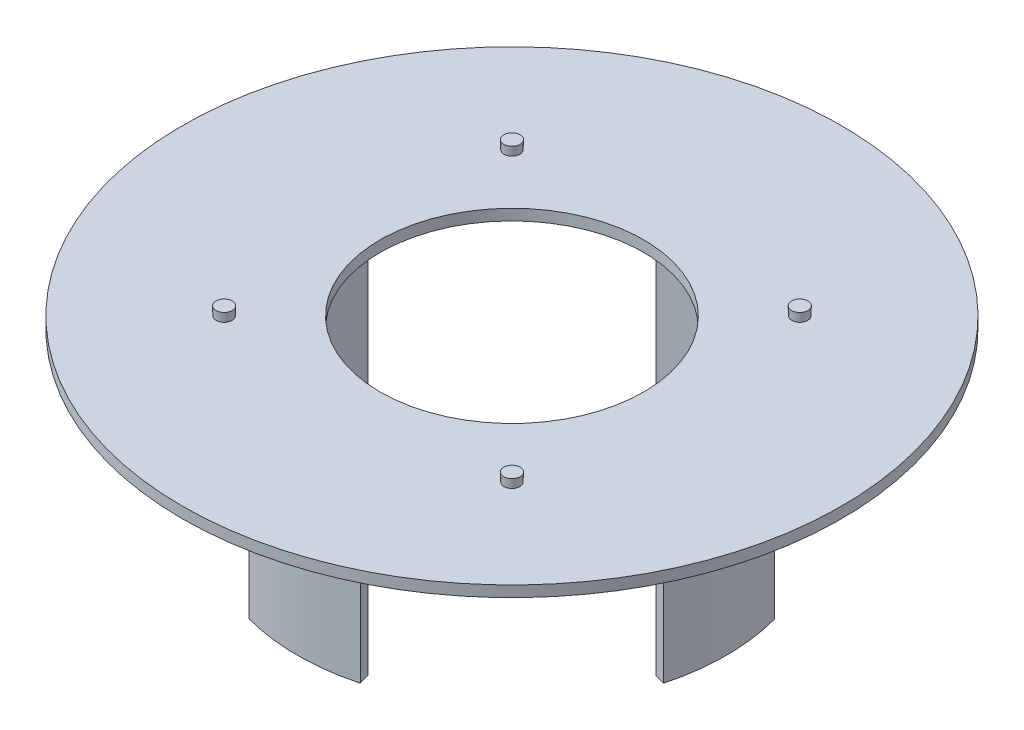
from build123d import *

# Parameters (mm, degrees)
SKETCH1_R                     = 75
SKETCH1_R_2                   = 30
BOSS_EXTRUDE1_DEPTH           = 2.5
SKETCH2_R                     = 1.8
BOSS_EXTRUDE2_DEPTH           = 2
BOSS_EXTRUDE2_DRAFT           = -2
BOSS_EXTRUDE2_PROFILE_2_DEPTH = 2
BOSS_EXTRUDE2_PROFILE_2_DRAFT = -2
BOSS_EXTRUDE2_PROFILE_3_DEPTH = 2
BOSS_EXTRUDE2_PROFILE_3_DRAFT = -2
BOSS_EXTRUDE2_PROFILE_4_DEPTH = 2
BOSS_EXTRUDE2_PROFILE_4_DRAFT = -2
BOSS_EXTRUDE3_DEPTH           = 40


with BuildPart() as part:
    # Sketch1 → Boss-Extrude1 (new body)
    with BuildSketch(Plane(origin=(0, 0, 0), x_dir=(1, 0, 0), z_dir=(0, 1, 0))):
        Circle(SKETCH1_R)
        Circle(SKETCH1_R_2, mode=Mode.SUBTRACT)
    extrude(amount=BOSS_EXTRUDE1_DEPTH)


with BuildPart() as boss_extrude2_tool:
    # Sketch2 → Boss-Extrude2 (with draft: the straight prism first)
    with BuildSketch(Plane(origin=(0, 2.5, 0), x_dir=(1, 0, 0), z_dir=(0, 1, 0))):
        with Locations((-32.75, 32.75)):
            Circle(SKETCH2_R)
    extrude(amount=BOSS_EXTRUDE2_DEPTH)
    # Boss-Extrude2: the draft: its side faces are tilted about the plane it starts from
    boss_extrude2_sides = [boss_extrude2_tool.faces().sort_by_distance(p)[0] for p in [
        (-34.55, 3.5, -32.75),
    ]]
    draft(boss_extrude2_sides, Plane(origin=(0, 2.5, 0), x_dir=(1, 0, 0), z_dir=(0, 1, 0)), BOSS_EXTRUDE2_DRAFT)


with BuildPart() as part_1:
    add(part.part)

    # Boss-Extrude2: add boss_extrude2_tool
    add(boss_extrude2_tool.part)


with BuildPart() as boss_extrude2_profile_2_tool:
    # Sketch2 → Boss-Extrude2 profile 2 (with draft: the straight prism first)
    with BuildSketch(Plane(origin=(0, 2.5, 0), x_dir=(1, 0, 0), z_dir=(0, 1, 0))):
        with Locations((-32.75, -32.75)):
            Circle(SKETCH2_R)
    extrude(amount=BOSS_EXTRUDE2_PROFILE_2_DEPTH)
    # Boss-Extrude2 profile 2: the draft: its side faces are tilted about the plane it starts from
    boss_extrude2_profile_2_sides = [boss_extrude2_profile_2_tool.faces().sort_by_distance(p)[0] for p in [
        (-34.55, 3.5, 32.75),
    ]]
    draft(boss_extrude2_profile_2_sides, Plane(origin=(0, 2.5, 0), x_dir=(1, 0, 0), z_dir=(0, 1, 0)), BOSS_EXTRUDE2_PROFILE_2_DRAFT)


with BuildPart() as part_2:
    add(part_1.part)

    # Boss-Extrude2 profile 2: add boss_extrude2_profile_2_tool
    add(boss_extrude2_profile_2_tool.part)


with BuildPart() as boss_extrude2_profile_3_tool:
    # Sketch2 → Boss-Extrude2 profile 3 (with draft: the straight prism first)
    with BuildSketch(Plane(origin=(0, 2.5, 0), x_dir=(1, 0, 0), z_dir=(0, 1, 0))):
        with Locations((32.75, -32.75)):
            Circle(SKETCH2_R)
    extrude(amount=BOSS_EXTRUDE2_PROFILE_3_DEPTH)
    # Boss-Extrude2 profile 3: the draft: its side faces are tilted about the plane it starts from
    boss_extrude2_profile_3_sides = [boss_extrude2_profile_3_tool.faces().sort_by_distance(p)[0] for p in [
        (30.95, 3.5, 32.75),
    ]]
    draft(boss_extrude2_profile_3_sides, Plane(origin=(0, 2.5, 0), x_dir=(1, 0, 0), z_dir=(0, 1, 0)), BOSS_EXTRUDE2_PROFILE_3_DRAFT)


with BuildPart() as part_3:
    add(part_2.part)

    # Boss-Extrude2 profile 3: add boss_extrude2_profile_3_tool
    add(boss_extrude2_profile_3_tool.part)


with BuildPart() as boss_extrude2_profile_4_tool:
    # Sketch2 → Boss-Extrude2 profile 4 (with draft: the straight prism first)
    with BuildSketch(Plane(origin=(0, 2.5, 0), x_dir=(1, 0, 0), z_dir=(0, 1, 0))):
        with Locations((32.75, 32.75)):
            Circle(SKETCH2_R)
    extrude(amount=BOSS_EXTRUDE2_PROFILE_4_DEPTH)
    # Boss-Extrude2 profile 4: the draft: its side faces are tilted about the plane it starts from
    boss_extrude2_profile_4_sides = [boss_extrude2_profile_4_tool.faces().sort_by_distance(p)[0] for p in [
        (30.95, 3.5, -32.75),
    ]]
    draft(boss_extrude2_profile_4_sides, Plane(origin=(0, 2.5, 0), x_dir=(1, 0, 0), z_dir=(0, 1, 0)), BOSS_EXTRUDE2_PROFILE_4_DRAFT)


with BuildPart() as part_4:
    add(part_3.part)

    # Boss-Extrude2 profile 4: add boss_extrude2_profile_4_tool
    add(boss_extrude2_profile_4_tool.part)

    # Sketch3 → Boss-Extrude3 (add)
    with BuildSketch(Plane(origin=(0, 0, 0), x_dir=(1, 0, 0), z_dir=(0, 1, 0))):
        with BuildLine():
            Line((-11.987331974, -44.737331974), (-12.634379587, -47.15214654))
            ThreePointArc((-12.634379587, -47.15214654), (0, -48.815494168), (12.634379587, -47.15214654))
            Line((12.634379587, -47.15214654), (11.987331974, -44.737331974))
            ThreePointArc((11.987331974, -44.737331974), (0, -46.315494168), (-11.987331974, -44.737331974))
        make_face()
        with BuildLine():
            Line((-44.737331974, -11.987331974), (-47.15214654, -12.634379587))
            ThreePointArc((-47.15214654, -12.634379587), (-48.815494168, 0), (-47.15214654, 12.634379587))
            Line((-47.15214654, 12.634379587), (-44.737331974, 11.987331974))
            ThreePointArc((-44.737331974, 11.987331974), (-46.315494168, 0), (-44.737331974, -11.987331974))
        make_face()
        with BuildLine():
            Line((-11.987331974, 44.737331974), (-12.634379587, 47.15214654))
            ThreePointArc((-12.634379587, 47.15214654), (0, 48.815494168), (12.634379587, 47.15214654))
            Line((12.634379587, 47.15214654), (11.987331974, 44.737331974))
            ThreePointArc((11.987331974, 44.737331974), (0, 46.315494168), (-11.987331974, 44.737331974))
        make_face()
        with BuildLine():
            Line((44.737331974, 11.987331974), (47.15214654, 12.634379587))
            ThreePointArc((47.15214654, 12.634379587), (48.815494168, 0), (47.15214654, -12.634379587))
            Line((47.15214654, -12.634379587), (44.737331974, -11.987331974))
            ThreePointArc((44.737331974, -11.987331974), (46.315494168, 0), (44.737331974, 11.987331974))
        make_face()
    extrude(amount=-BOSS_EXTRUDE3_DEPTH)


solid = part_4.part
